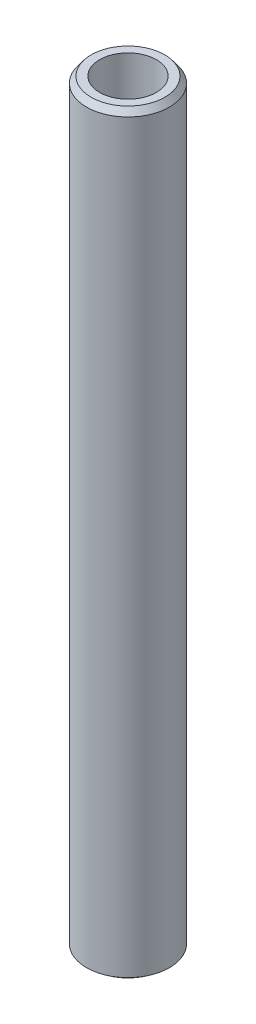
from build123d import *
from OCP.BRepFilletAPI import BRepFilletAPI_MakeChamfer

# Parameters (mm, degrees)
SKETCH1_R           = 15
BOSS_EXTRUDE1_DEPTH = 273.534332492
SKETCH2_R           = 10.272901886
CUT_EXTRUDE1_DEPTH  = 275.355665244
CHAMFER1_SIZE       = 2.232005374
CHAMFER1_SIZE2      = 1.688190592


with BuildPart() as part:
    # Sketch1 → Boss-Extrude1 (new body)
    with BuildSketch(Plane(origin=(0, 0, 0), x_dir=(1, 0, 0), z_dir=(0, 1, 0))):
        Circle(SKETCH1_R)
    extrude(amount=BOSS_EXTRUDE1_DEPTH)

    # Sketch2 → Cut-Extrude1 (cut, through all)
    with BuildSketch(Plane(origin=(0, 0, 0), x_dir=(1, 0, 0), z_dir=(0, 1, 0))):
        Circle(SKETCH2_R)
    extrude(amount=CUT_EXTRUDE1_DEPTH, mode=Mode.SUBTRACT)

    # Chamfer1: one chamfer whose edges measure the first distance from different faces: ONE call of the kernel's chamfer builder (chamfer() names one face for all edges)
    chamfer1_edges_1 = [part.edges().sort_by_distance(p)[0] for p in [
        (-15, 273.534332492, 0),
    ]]
    chamfer1_side_1 = [part.faces().sort_by_distance(p)[0] for p in [
        (-15, 136.767166246, 0),
    ]]
    chamfer1_edges_2 = [part.edges().sort_by_distance(p)[0] for p in [
        (-15, 0, 0),
    ]]
    chamfer1_side_2 = [part.faces().sort_by_distance(p)[0] for p in [
        (-14.575735931, 0, 0),
    ]]
    chamfer1 = BRepFilletAPI_MakeChamfer(part.part.solid().wrapped)
    for e in chamfer1_edges_1:
        chamfer1.Add(CHAMFER1_SIZE, CHAMFER1_SIZE2, e.wrapped, chamfer1_side_1[0].wrapped)  # the first distance lies on this face
    for e in chamfer1_edges_2:
        chamfer1.Add(CHAMFER1_SIZE, CHAMFER1_SIZE2, e.wrapped, chamfer1_side_2[0].wrapped)  # the first distance lies on this face
    add(Compound.cast(chamfer1.Shape()), mode=Mode.REPLACE)


solid = part.part
